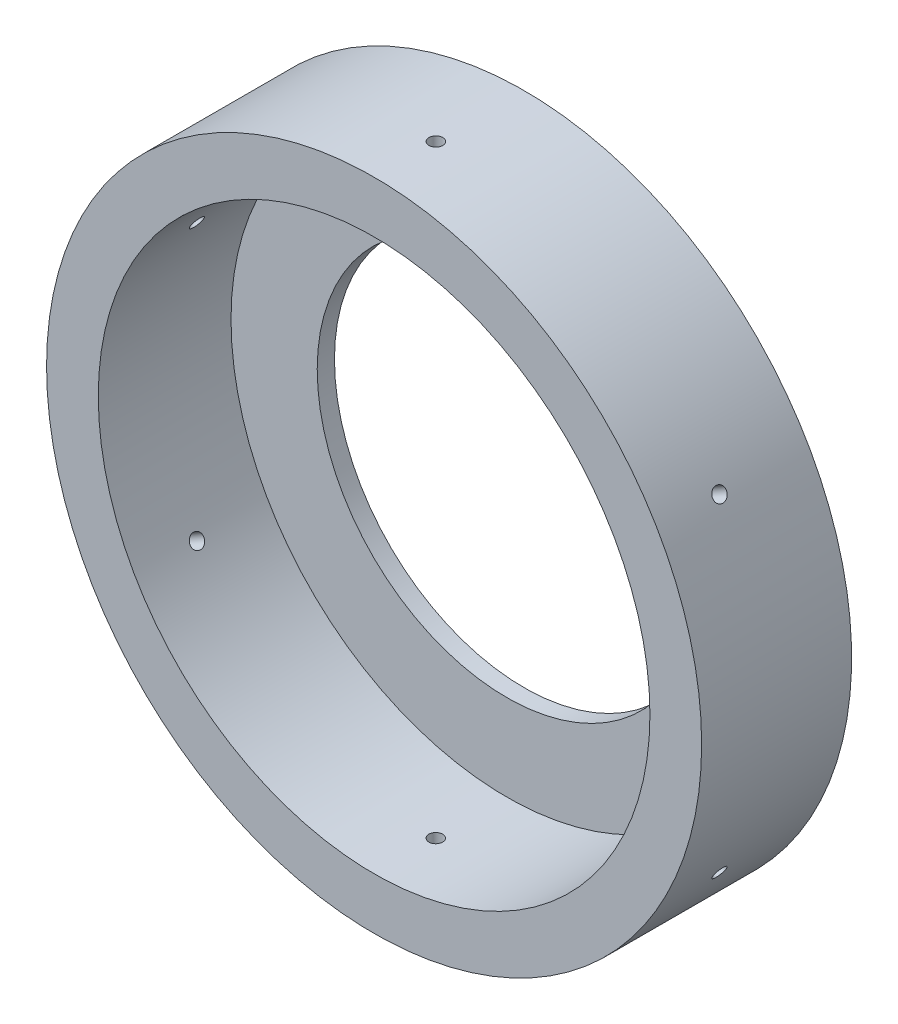
from build123d import *
from build123d.topology import SkipClean

# Parameters (mm, degrees)
SKETCH_1_R               = 95
SKETCH_1_R_2             = 55
EXTRUDE_1_DEPTH          = 5
SKETCH_2_R               = 95
SKETCH_2_R_2             = 80
EXTRUDE_2_DEPTH          = 38.5
SKETCH_3_R               = 2
CUT_EXTRUDE_2_DEPTH      = 100
PATTERN_CIRCULAR_2_COUNT = 6
SKETCH_5_R               = 80
CUT_EXTRUDE_3_DEPTH      = 20
EXTRUDE_START            = 5
SKETCH_6_R               = 95
SKETCH_6_R_2             = 55
EXTRUDE_3_DEPTH          = 5


with BuildPart() as part:
    # 草图1 → 凸台-拉伸1 (new body)
    with BuildSketch(Plane.XY):
        Circle(SKETCH_1_R)
        Circle(SKETCH_1_R_2, mode=Mode.SUBTRACT)
    extrude(amount=EXTRUDE_1_DEPTH)

    # 草图2 → 凸台-拉伸2 (add)
    with BuildSketch(Plane.XY):
        Circle(SKETCH_2_R)
        Circle(SKETCH_2_R_2, mode=Mode.SUBTRACT)
    extrude(amount=EXTRUDE_2_DEPTH)

    # 草图3 → 切除-拉伸2 (cut)
    with BuildSketch(Plane(origin=(0, 0, 0), x_dir=(1, 0, 0), z_dir=(0, 1, 0))):
        with Locations((0, -20.6)):
            Circle(SKETCH_3_R)
    cut_extrude_2 = extrude(amount=-CUT_EXTRUDE_2_DEPTH, mode=Mode.SUBTRACT)

    # 阵列(圆周)2: 切除-拉伸2 ×6 about axis
    pattern_circular_2_axis = Axis((0, 0, 5), (0, 0, -1))
    for i in range(1, PATTERN_CIRCULAR_2_COUNT):
        add(cut_extrude_2.rotate(pattern_circular_2_axis, i * 360 / PATTERN_CIRCULAR_2_COUNT), mode=Mode.SUBTRACT)

    # 草图5 → 切除-拉伸3 (cut)
    with SkipClean():  # the faces are left unmerged after this step: merging them gives an invalid solid
        with BuildSketch(Plane(origin=(0, 0, 0), x_dir=(-1, 0, 0), z_dir=(0, 0, -1))):
            Circle(SKETCH_5_R)
        extrude(amount=-CUT_EXTRUDE_3_DEPTH, mode=Mode.SUBTRACT)
    add(part.part.scale(1), mode=Mode.REPLACE)  # the faces are merged on a copy

    # 草图6 → 凸台-拉伸3 (add)
    with SkipClean():  # the faces are left unmerged after this step: merging them gives an invalid solid
        with BuildSketch(Plane(origin=(0, 0, 0), x_dir=(-1, 0, 0), z_dir=(0, 0, -1)).offset(EXTRUDE_START)):
            Circle(SKETCH_6_R)
            Circle(SKETCH_6_R_2, mode=Mode.SUBTRACT)
        extrude(amount=-EXTRUDE_3_DEPTH)


solid = part.part
